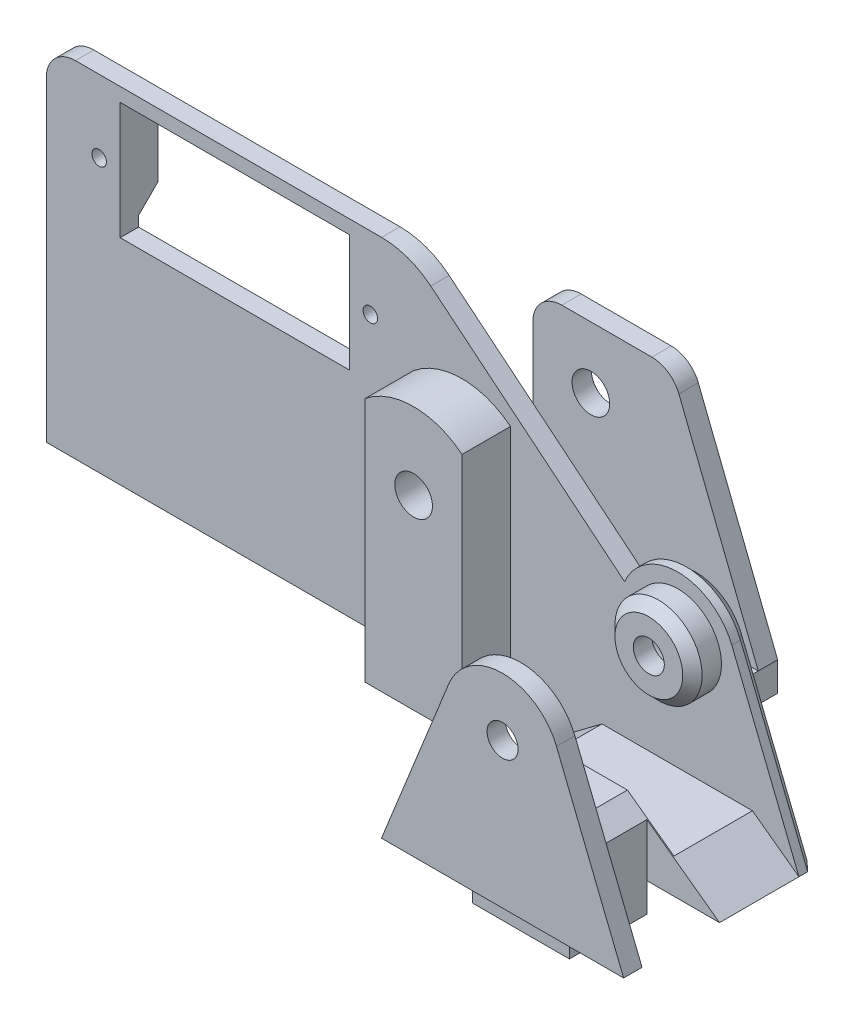
from build123d import *

# Parameters (mm, degrees)
CROQUIS1_R                 = 1.6
SALIENTE_EXTRUIR1_DEPTH    = 10
CORTAR_EXTRUIR1_DEPTH      = 8.1
CORTAR_EXTRUIR1_DEPTH_BACK = 8.1
CORTAR_EXTRUIR2_START      = 8.1
CROQUIS3_OUTSIDE_W         = 34.658
CROQUIS3_OUTSIDE_H         = 30.658
CROQUIS3_OUTSIDE_W_2       = 10
CROQUIS3_OUTSIDE_H_2       = 25.797501395
CORTAR_EXTRUIR2_DEPTH      = 8
CROQUIS4_W                 = 10
CROQUIS4_H                 = 8
SALIENTE_EXTRUIR3_DEPTH    = 3
CORTAR_EXTRUIR3_DEPTH      = 25.088378941
CORTAR_EXTRUIR3_DEPTH_BACK = 25.088378941
CROQUIS5_W                 = 8.1
CROQUIS5_H                 = 3.5
CROQUIS6_R                 = 4.5
CROQUIS6_R_2               = 1.6
SALIENTE_EXTRUIR4_DEPTH    = 3
CHAFL_N1_SIZE              = 1
CROQUIS7_R                 = 3.5
CORTAR_EXTRUIR4_DEPTH      = 3
SALIENTE_EXTRUIR8_START    = -1.9
CROQUIS8_R                 = 0.75
CROQUIS8_R_2               = 1.945
CROQUIS8_W                 = 23.65
CROQUIS8_H                 = 12.1
SALIENTE_EXTRUIR8_DEPTH    = 1.9
SALIENTE_EXTRUIR9_START    = 5
CROQUIS9_R                 = 1.945
SALIENTE_EXTRUIR9_DEPTH    = 5
CROQUIS10_W                = 23.280139212
CROQUIS10_H                = 3
SALIENTE_EXTRUIR10_DEPTH   = 11.4
CROQUIS11_R                = 1.945
SALIENTE_EXTRUIR11_DEPTH   = 2
REDONDEO1_R                = 3
CROQUIS12_W                = 4.35
CROQUIS12_H                = 6
CROQUIS12_R                = 0.75
SALIENTE_EXTRUIR12_DEPTH   = 2
CHAFL_N3_SIZE              = 2
CHAFL_N2_SIZE              = 1


# Some blends are built 0.0001 mm under size
with BuildPart() as part:
    # Croquis1 → Saliente-Extruir1 (new, symmetric)
    with BuildSketch(Plane.XY):
        with BuildLine():
            Line((-12.5, -15), (-5.566639674, 2.238866395))
            ThreePointArc((-5.566639674, 2.238866395), (0, 6), (5.566639674, 2.238866395))
            Line((5.566639674, 2.238866395), (12.5, -15))
            Line((12.5, -15), (-12.5, -15))
        make_face()
        Circle(CROQUIS1_R, mode=Mode.SUBTRACT)
    extrude(amount=SALIENTE_EXTRUIR1_DEPTH, both=True)

    # Croquis2 → Cortar-Extruir1 (cut, two sides: drawn at the far end of the back side and taken through both)
    with BuildSketch(Plane.XY.offset(-CORTAR_EXTRUIR1_DEPTH_BACK)):
        with BuildLine():
            Line((-12.5, -15), (-7.5, 0))
            ThreePointArc((-7.5, 0), (0, 7.5), (7.5, 0))
            Line((7.5, 0), (12.5, -15))
            Line((12.5, -15), (2.888582809, -8))
            Line((2.888582809, -8), (-3.164835235, -8))
            Line((-3.164835235, -8), (-12.5, -15))
        make_face()
    extrude(amount=CORTAR_EXTRUIR1_DEPTH + CORTAR_EXTRUIR1_DEPTH_BACK, mode=Mode.SUBTRACT)

    # Croquis3 outside → Cortar-Extruir2 (cut)
    with BuildSketch(Plane.XY.offset(CORTAR_EXTRUIR2_START)):
        with Locations((0, -4.5)):
            Rectangle(CROQUIS3_OUTSIDE_W, CROQUIS3_OUTSIDE_H)
        with Locations((0, -2.101249303)):
            Rectangle(CROQUIS3_OUTSIDE_W_2, CROQUIS3_OUTSIDE_H_2, mode=Mode.SUBTRACT)
    extrude(amount=-CORTAR_EXTRUIR2_DEPTH, mode=Mode.SUBTRACT)

    # Croquis4 → Saliente-Extruir3 (add)
    with BuildSketch(Plane.XZ.offset(15)):
        with Locations((0, 4.1)):
            Rectangle(CROQUIS4_W, CROQUIS4_H)
    extrude(amount=SALIENTE_EXTRUIR3_DEPTH)

    # Croquis5 → Cortar-Extruir3 (cut, two sides: drawn at the far end of the back side and taken through both)
    with BuildSketch(Plane(origin=(0, 0, 0), x_dir=(0, 0, -1), z_dir=(1, 0, 0)).offset(-CORTAR_EXTRUIR3_DEPTH_BACK)):
        with Locations((4.05, -9.75)):
            Rectangle(CROQUIS5_W, CROQUIS5_H)
    extrude(amount=CORTAR_EXTRUIR3_DEPTH + CORTAR_EXTRUIR3_DEPTH_BACK, mode=Mode.SUBTRACT)

    # Croquis6 → Saliente-Extruir4 (add)
    with BuildSketch(Plane.XY.offset(-8.1)):
        Circle(CROQUIS6_R)
        Circle(CROQUIS6_R_2, mode=Mode.SUBTRACT)
    extrude(amount=SALIENTE_EXTRUIR4_DEPTH)

    # Chaflán1
    chafl_n1_edges = [part.edges().sort_by_distance(p)[0] for p in [
        (-4.5, 0, -5.1),
    ]]
    chamfer(chafl_n1_edges, length=CHAFL_N1_SIZE)

    # Croquis7 → Cortar-Extruir4 (cut)
    with BuildSketch(Plane(origin=(0, 0, -10), x_dir=(-1, 0, 0), z_dir=(0, 0, -1))):
        Circle(CROQUIS7_R)
    extrude(amount=-CORTAR_EXTRUIR4_DEPTH, mode=Mode.SUBTRACT)

    # Croquis8 → Saliente-Extruir8 (add)
    with BuildSketch(Plane(origin=(0, 0, -10), x_dir=(-1, 0, 0), z_dir=(0, 0, -1)).offset(SALIENTE_EXTRUIR8_START)):
        with BuildLine():
            Line((65.2, -15), (65.2, 20.621697606))
            Line((65.2, 20.621697606), (30.587310575, 20.621717655))
            ThreePointArc((30.587310575, 20.621717655), (27.892014915, 20.154008561), (25.511873338, 18.805566286))
            Line((25.511873338, 18.805566286), (5.505516372, 2.38522315))
            ThreePointArc((5.505516372, 2.38522315), (5.536561655, 2.312246753), (5.566639674, 2.238866395))
            Line((5.566639674, 2.238866395), (12.5, -15))
            Line((12.5, -15), (65.2, -15))
        make_face()
        with Locations((59.747279072, 13.15)):
            Circle(CROQUIS8_R, mode=Mode.SUBTRACT)
        with Locations((31.747279072, 13.15)):
            Circle(CROQUIS8_R, mode=Mode.SUBTRACT)
        with Locations((22.280139212, 4.212923787)):
            Circle(CROQUIS8_R_2, mode=Mode.SUBTRACT)
        with Locations((45.747279072, 13.15)):
            Rectangle(CROQUIS8_W, CROQUIS8_H, mode=Mode.SUBTRACT)
    extrude(amount=SALIENTE_EXTRUIR8_DEPTH)

    # Croquis9 → Saliente-Extruir9 (add)
    with BuildSketch(Plane.XY.offset(-8.1).offset(SALIENTE_EXTRUIR9_START)):
        with BuildLine():
            Line((-27.280139212, -15), (-17.280139212, -15))
            Line((-17.280139212, -15), (-17.280139212, 10.371029295))
            ThreePointArc((-17.280139212, 10.371029295), (-22.280139212, 12.145279266), (-27.280139212, 10.371029295))
            Line((-27.280139212, 10.371029295), (-27.280139212, -15))
        make_face()
        with Locations(Location((-22.280139212, 4.212923787, 0), (0, 0, 180))):
            Circle(CROQUIS9_R, mode=Mode.SUBTRACT)
    extrude(amount=-SALIENTE_EXTRUIR9_DEPTH)

    # Croquis10 → Saliente-Extruir10 (add)
    with BuildSketch(Plane(origin=(0, 0, -10), x_dir=(-1, 0, 0), z_dir=(0, 0, -1))):
        with Locations((16.640069606, -13.5)):
            Rectangle(CROQUIS10_W, CROQUIS10_H)
    extrude(amount=SALIENTE_EXTRUIR10_DEPTH)

    # Croquis11 → Saliente-Extruir11 (add)
    with BuildSketch(Plane(origin=(0, 0, -21.4), x_dir=(-1, 0, 0), z_dir=(0, 0, -1))):
        Polygon((28.280139212, -15), (28.280139212, 10.566063957), (13.946510162, 10.566063957), (5, -12), (5, -15), align=None)
        with Locations((22.280139212, 4.212923787)):
            Circle(CROQUIS11_R, mode=Mode.SUBTRACT)
    extrude(amount=SALIENTE_EXTRUIR11_DEPTH)

    # Redondeo1
    redondeo1_edges = [part.edges().sort_by_distance(p)[0] for p in [
        (-65.2, 20.621697606, -9.05),
        (-28.280139212, 10.566063957, -22.4),
        (-13.946510162, 10.566063957, -22.4),
    ]]
    fillet(redondeo1_edges, radius=REDONDEO1_R)

    # Croquis12 → Saliente-Extruir12 (add)
    # profile 1 of 2: a face of its own
    with BuildSketch(Plane(origin=(0, 0, -10), x_dir=(-1, 0, 0), z_dir=(0, 0, -1))):
        with Locations((31.747279072, 13.15)):
            Rectangle(CROQUIS12_W, CROQUIS12_H)
        with Locations((31.747279072, 13.15)):
            Circle(CROQUIS12_R, mode=Mode.SUBTRACT)
    # profile 2 of 2: a face of its own
    with BuildSketch(Plane(origin=(0, 0, -10), x_dir=(-1, 0, 0), z_dir=(0, 0, -1))):
        with Locations((59.747279072, 13.15)):
            Rectangle(CROQUIS12_W, CROQUIS12_H)
        with Locations((59.747279072, 13.15)):
            Circle(CROQUIS12_R, mode=Mode.SUBTRACT)
    extrude(amount=SALIENTE_EXTRUIR12_DEPTH)

    # Chaflán3
    chafl_n3_edges = [part.edges().sort_by_distance(p)[0] for p in [
        (-31.747279072, 16.15, -10),
        (-31.747279072, 10.15, -10),
        (-59.747279072, 10.15, -10),
        (-59.747279072, 16.15, -10),
    ]]
    chamfer(chafl_n3_edges, length=CHAFL_N3_SIZE - 0.0001)  # a hair under: the kernel refuses the full size

    # Chaflán2
    # the kernel refuses this chamfer: 1 mm, written as the material it takes off along each edge
    with BuildSketch(Plane(origin=(0, 0, -10), x_dir=(-0.9997966291820871, -0.020166811253548467, 0), z_dir=(0.020166811253548467, -0.9997966291820871, 0))) as chafl_n2_piece_1_section:
        Polygon((6, -CHAFL_N2_SIZE), (6 - CHAFL_N2_SIZE, 0), (6, 0), align=None)
    chafl_n2_piece_1 = revolve(axis=Axis((0, 0, -10), (0, 0, -1)), revolution_arc=159.245879782, mode=Mode.PRIVATE)
    chafl_n2_piece_1 = split(chafl_n2_piece_1, bisect_by=Plane(origin=(-3.804583519, 0.989171828, -9.513770005), z_dir=(0.6344290754241263, 0.7729810788476574, 0)), keep=Keep.TOP, mode=Mode.PRIVATE)
    add(chafl_n2_piece_1, mode=Mode.SUBTRACT)
    with BuildSketch(Plane(origin=(5.566639674, 2.238866395, -10), x_dir=(0.02550993960358281, 0.01025993235875113, 0.9996219169112968), z_dir=(0.3731443992151493, -0.9277732790581789, 0))) as chafl_n2_piece_2:
        Polygon((CHAFL_N2_SIZE * 0.999621916911, CHAFL_N2_SIZE * 0.0274958766106), (-CHAFL_N2_SIZE * 0.0274958766106, CHAFL_N2_SIZE * 0.999621916911), (0, 0), align=None)
    extrude(amount=21.152587164, mode=Mode.SUBTRACT)


solid = part.part
